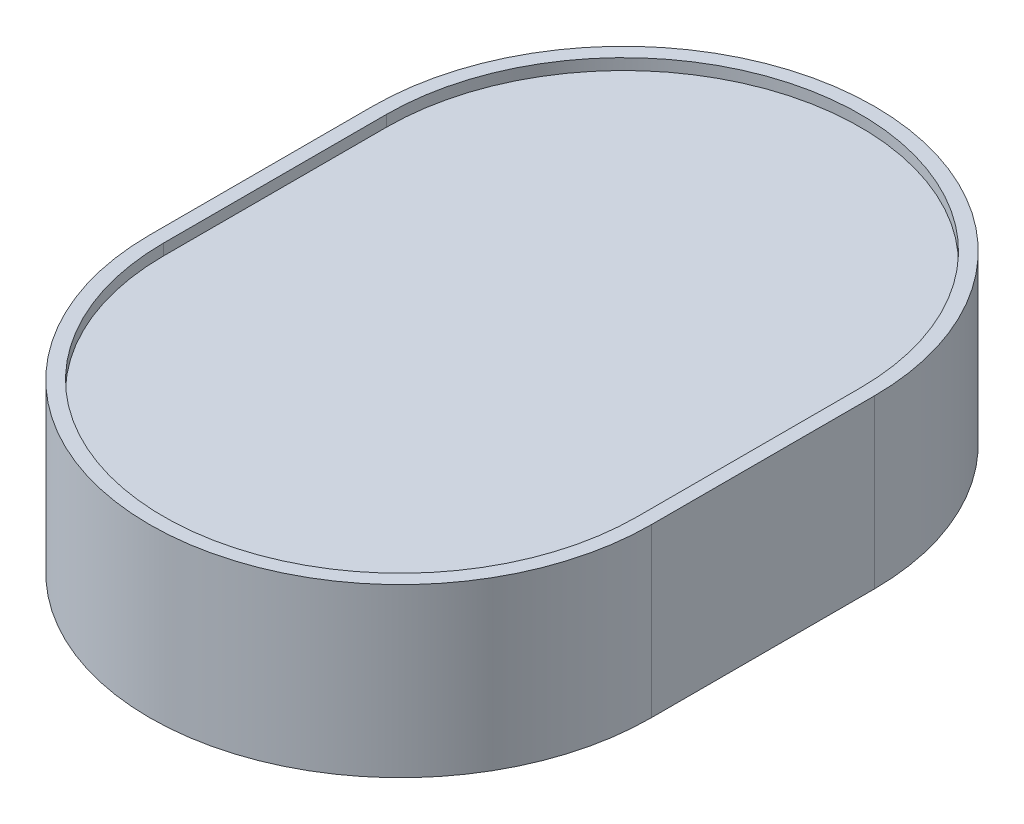
from build123d import *

# Parameters (mm, degrees)
BOSS_EXTRUDE1_DEPTH = 6
CUT_EXTRUDE1_DEPTH  = 0.4


with BuildPart() as part:
    # Sketch1 → Boss-Extrude1 (new body)
    with BuildSketch(Plane(origin=(0, 0, 0), x_dir=(1, 0, 0), z_dir=(0, 1, 0))):
        with BuildLine():
            Line((-9, -4), (-9, 4))
            ThreePointArc((-9, 4), (0, 13), (9, 4))
            Line((9, 4), (9, -4))
            ThreePointArc((9, -4), (0, -13), (-9, -4))
        make_face()
    extrude(amount=BOSS_EXTRUDE1_DEPTH)

    # Sketch2 → Cut-Extrude1 (cut)
    with BuildSketch(Plane(origin=(0, 6, 0), x_dir=(1, 0, 0), z_dir=(0, 1, 0))):
        with BuildLine():
            Line((-8.5, -4), (-8.5, 4))
            ThreePointArc((-8.5, 4), (0, 12.5), (8.5, 4))
            Line((8.5, 4), (8.5, -4))
            ThreePointArc((8.5, -4), (0, -12.5), (-8.5, -4))
        make_face()
    extrude(amount=-CUT_EXTRUDE1_DEPTH, mode=Mode.SUBTRACT)


solid = part.part
